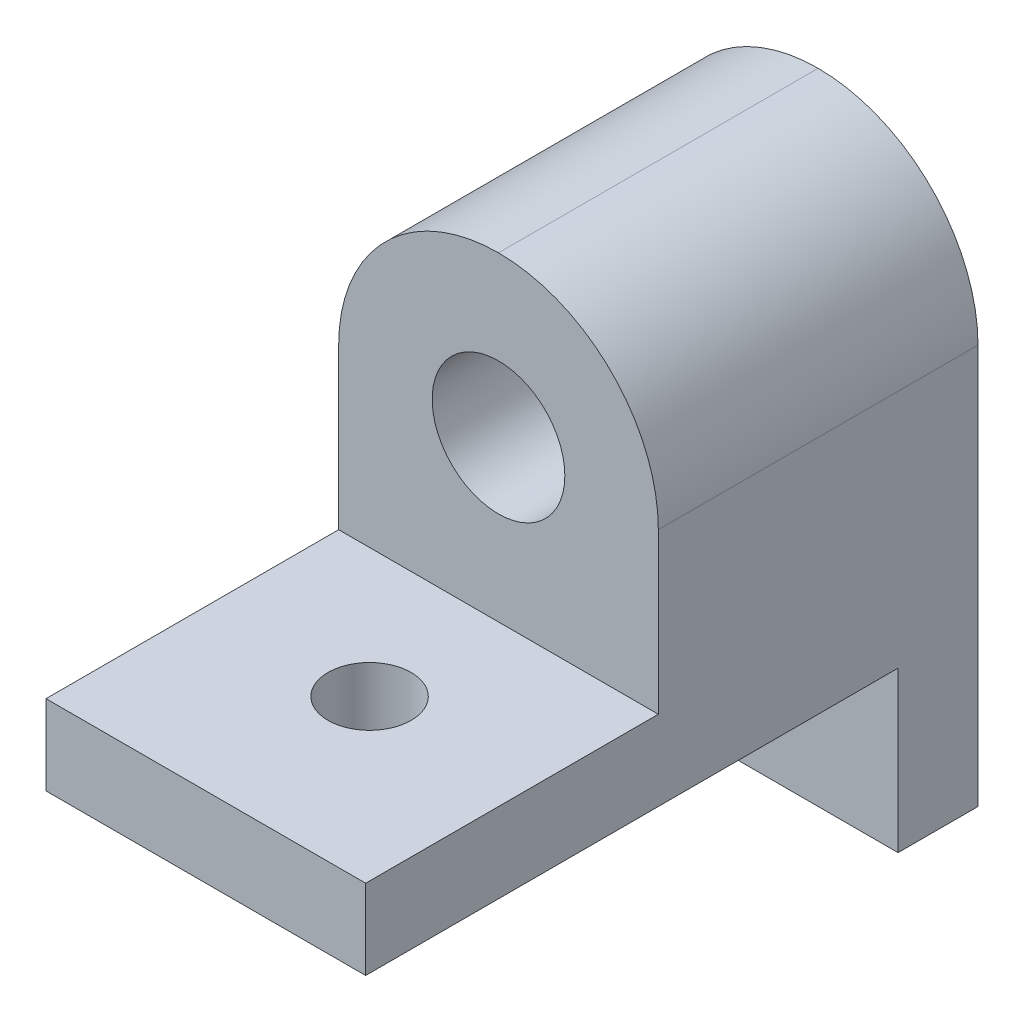
from build123d import *

# Parameters (mm, degrees)
SKETCH_1_W          = 20
SKETCH_1_H          = 40
EXTRUDE_1_DEPTH     = 5
SKETCH_2_W          = 20
SKETCH_2_H          = 20
EXTRUDE_2_DEPTH     = 20
SKETCH_3_R          = 4.15
CUT_EXTRUDE_1_DEPTH = 42.044142746
FILLET_1_R          = 10
SKETCH_6_W          = 20
SKETCH_6_H          = 25.791536141
CUT_EXTRUDE_3_DEPTH = 54.65112416
SKETCH_7_W          = 20
SKETCH_7_H          = 5
EXTRUDE_5_DEPTH     = 10
SKETCH_8_W          = 20
SKETCH_8_H          = 5
EXTRUDE_6_DEPTH     = 10
SKETCH_10_R         = 1.6
CUT_EXTRUDE_5_DEPTH = 45.828803841
SKETCH_11_W         = 20
SKETCH_11_H         = 5
EXTRUDE_7_DEPTH     = 20
SKETCH_12_R         = 2.6
CUT_EXTRUDE_7_DEPTH = 82.655934826
SKETCH_13_W         = 20
SKETCH_13_H         = 21.689007925
CUT_EXTRUDE_8_DEPTH = 82.655934826


with BuildPart() as part:
    # 草图1 → 凸台-拉伸1 (new body)
    with BuildSketch(Plane(origin=(0, 0, 0), x_dir=(1, 0, 0), z_dir=(0, 1, 0))):
        with Locations((2.634146341, -28.154142811)):
            Rectangle(SKETCH_1_W, SKETCH_1_H)
    extrude(amount=EXTRUDE_1_DEPTH)

    # 草图2 → 凸台-拉伸2 (add)
    with BuildSketch(Plane(origin=(0, 5, 0), x_dir=(1, 0, 0), z_dir=(0, 1, 0))):
        with Locations((2.634146341, -28.154142811)):
            Rectangle(SKETCH_2_W, SKETCH_2_H)
    extrude(amount=EXTRUDE_2_DEPTH)

    # 草图3 → 切除-拉伸1 (cut, through all)
    with BuildSketch(Plane.XY.offset(38.154142811)):
        with Locations((2.634146341, 15)):
            Circle(SKETCH_3_R)
    extrude(amount=-CUT_EXTRUDE_1_DEPTH, mode=Mode.SUBTRACT)

    # 圆角1
    fillet_1_edges = [part.edges().sort_by_distance(p)[0] for p in [
        (12.634146341, 25, 28.154142811),
        (-7.365853659, 25, 28.154142811),
    ]]
    fillet(fillet_1_edges, radius=FILLET_1_R - 0.0001)  # a hair under: the kernel refuses the full size

    # 草图6 → 切除-拉伸3 (cut, through all)
    with BuildSketch(Plane(origin=(0, 5, 0), x_dir=(1, 0, 0), z_dir=(0, 1, 0))):
        with Locations((2.634146341, -5.25837474)):
            Rectangle(SKETCH_6_W, SKETCH_6_H)
    extrude(amount=-CUT_EXTRUDE_3_DEPTH, mode=Mode.SUBTRACT)

    # 草图7 → 凸台-拉伸5 (add)
    with BuildSketch(Plane.XZ):
        with Locations((2.634146341, 20.654142811)):
            Rectangle(SKETCH_7_W, SKETCH_7_H)
    extrude(amount=EXTRUDE_5_DEPTH)

    # 草图8 → 凸台-拉伸6 (add)
    with BuildSketch(Plane.XY.offset(48.154142811)):
        with Locations((2.634146341, 2.5)):
            Rectangle(SKETCH_8_W, SKETCH_8_H)
    extrude(amount=EXTRUDE_6_DEPTH)

    # 草图10 → 切除-拉伸5 (cut, through all)
    with BuildSketch(Plane.XY.offset(23.154142811)):
        with Locations((2.634146341, -5)):
            Circle(SKETCH_10_R)
    extrude(amount=-CUT_EXTRUDE_5_DEPTH, mode=Mode.SUBTRACT)

    # 草图11 → 凸台-拉伸7 (add)
    with BuildSketch(Plane.XY.offset(58.154142811)):
        with Locations((2.634146341, 2.5)):
            Rectangle(SKETCH_11_W, SKETCH_11_H)
    extrude(amount=EXTRUDE_7_DEPTH)

    # 草图12 → 切除-拉伸7 (cut, through all)
    with BuildSketch(Plane(origin=(0, 5, 0), x_dir=(1, 0, 0), z_dir=(0, 1, 0))):
        with Locations(Location((2.634146341, -46.221727325, 0), (0, 0, 270))):
            Circle(SKETCH_12_R)
        with Locations(Location((2.634146341, -72.110167443, 0), (0, 0, 270))):
            Circle(SKETCH_12_R)
    extrude(amount=-CUT_EXTRUDE_7_DEPTH, mode=Mode.SUBTRACT)

    # 草图13 → 切除-拉伸8 (cut, through all)
    with BuildSketch(Plane(origin=(0, 5, 0), x_dir=(1, 0, 0), z_dir=(0, 1, 0))):
        with Locations((2.634146341, -67.309638849)):
            Rectangle(SKETCH_13_W, SKETCH_13_H)
    extrude(amount=-CUT_EXTRUDE_8_DEPTH, mode=Mode.SUBTRACT)


solid = part.part
